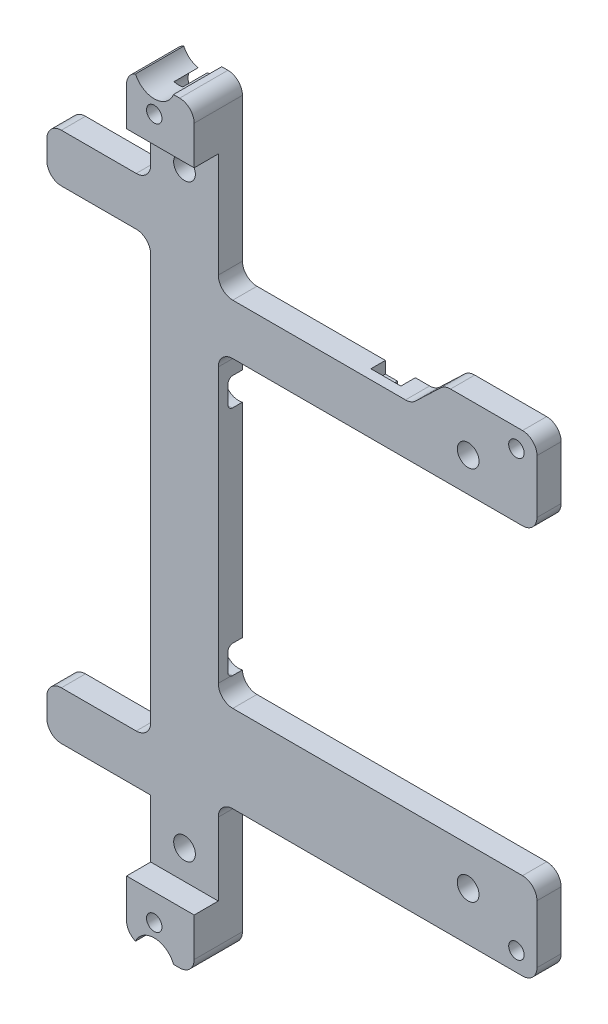
from build123d import *

# Parameters (mm, degrees)
SKETCH1_R           = 2.25
SKETCH1_R_2         = 1.6
SKETCH1_R_3         = 3
BOSS_EXTRUDE1_DEPTH = 5
SKETCH5_R           = 3
SKETCH5_R_2         = 1
SKETCH5_W           = 4.01788871
SKETCH5_H           = 5.05699797
SKETCH5_W_2         = 7.221096787
SKETCH5_H_2         = 2.706459824
CUT_EXTRUDE1_DEPTH  = 3
SKETCH7_W           = 14
SKETCH7_H           = 11
BOSS_EXTRUDE2_DEPTH = 5
SKETCH8_R           = 1.6
CUT_EXTRUDE2_DEPTH  = 10
FILLET1_R           = 3
FILLET2_R           = 1
SKETCH9_R           = 4.25
CUT_EXTRUDE3_DEPTH  = 10
SKETCH10_R          = 3
CUT_EXTRUDE4_DEPTH  = 2


with BuildPart() as part:
    # Sketch1 → Boss-Extrude1 (new body)
    with BuildSketch(Plane(origin=(0, 0, 0), x_dir=(0, 1, 0), z_dir=(0, 0, 1))):
        Polygon((-55, 65.745), (-55, 87.245), (-45, 87.245), (-45, 65.745), (45, 65.745), (45, 87.245), (55, 87.245), (55, 65.745), (78, 65.745), (78, 51.745), (42.265075728, 51.745), (42.265075728, 11.770466836), (48.886616847, 4.844257549), (48.886616847, -14.255), (31.792037683, -14.255), (31.792037683, 51.745), (-30.947612999, 51.745), (-30.947612999, -14.255), (-48.947612999, -14.255), (-48.947612999, 51.745), (-78, 51.745), (-78, 65.745), align=None)
        with Locations((-38.86, 0.005)):
            Circle(SKETCH1_R, mode=Mode.SUBTRACT)
        with Locations((38.86, -0.005)):
            Circle(SKETCH1_R, mode=Mode.SUBTRACT)
        with Locations((-60.99, 58.735)):
            Circle(SKETCH1_R, mode=Mode.SUBTRACT)
        with Locations((60.98, 58.745)):
            Circle(SKETCH1_R, mode=Mode.SUBTRACT)
        with Locations((-45, -9.995)):
            Circle(SKETCH1_R_2, mode=Mode.SUBTRACT)
        with Locations((45, -9.995)):
            Circle(SKETCH1_R_2, mode=Mode.SUBTRACT)
        with Locations((-72.5, 60.005)):
            Circle(SKETCH1_R_3, mode=Mode.SUBTRACT)
        with Locations((72.5, 60.005)):
            Circle(SKETCH1_R_3, mode=Mode.SUBTRACT)
    extrude(amount=BOSS_EXTRUDE1_DEPTH)

    # Sketch5 → Cut-Extrude1 (cut)
    with BuildSketch(Plane(origin=(0, 0, 0), x_dir=(1, 0, 0), z_dir=(0, 0, -1))):
        with Locations((-52.538289625, -22.861149672)):
            Circle(SKETCH5_R)
        with Locations((-52.538289625, 25.154380101)):
            Circle(SKETCH5_R)
        with Locations((-10.614990929, 46.988387136)):
            Circle(SKETCH5_R_2)
        with Locations((-10.614990929, 39.388387136)):
            Circle(SKETCH5_R_2)
        Polygon((-16.391055464, -39.808942168), (-15.937269245, -39.808942168), (-15.937269245, -44.809430542), (-22.144073086, -44.809430542), (-22.144073086, -39.808942168), (-19.62448258, -39.808942168), (-19.62448258, -37.764076849), (-16.391055464, -37.764076849), align=None)
        with Locations((-55.538289625, -11.127400084)):
            Rectangle(SKETCH5_W, SKETCH5_H)
        with Locations((-34.134669053, -31.792037683)):
            Rectangle(SKETCH5_W_2, SKETCH5_H_2)
    extrude(amount=-CUT_EXTRUDE1_DEPTH, mode=Mode.SUBTRACT)

    # Sketch7 → Boss-Extrude2 (add)
    with BuildSketch(Plane.XY.offset(5)):
        with Locations((-58.745, 72.5)):
            Rectangle(SKETCH7_W, SKETCH7_H)
        with Locations((-58.745, -72.5)):
            Rectangle(SKETCH7_W, SKETCH7_H)
    extrude(amount=BOSS_EXTRUDE2_DEPTH)

    # Sketch8 → Cut-Extrude2 (cut)
    with BuildSketch(Plane.XY.offset(10)):
        with Locations((-60.005, 72.5)):
            Circle(SKETCH8_R)
        with Locations((-60.005, -72.5)):
            Circle(SKETCH8_R)
    extrude(amount=-CUT_EXTRUDE2_DEPTH, mode=Mode.SUBTRACT)

    # Fillet1
    fillet1_edges = [part.edges().sort_by_distance(p)[0] for p in [
        (-51.745, -30.947612999, 2.5),
        (-65.745, -45, 2.5),
        (-87.245, -45, 2.5),
        (-87.245, -55, 2.5),
        (14.255, -48.947612999, 2.5),
        (14.255, -30.947612999, 2.5),
        (-51.745, 31.792037683, 2.5),
        (-65.745, 45, 2.5),
        (-87.245, 45, 2.5),
        (-87.245, 55, 2.5),
        (-11.770466836, 42.265075728, 2.5),
        (-4.844257549, 48.886616847, 2.5),
        (14.255, 31.792037683, 2.5),
        (14.255, 48.886616847, 2.5),
        (-51.745, 42.265075728, 2.5),
        (-51.745, 78, 5),
        (-65.745, 55, 2.5),
        (-65.745, 78, 5),
        (-51.745, -48.947612999, 2.5),
        (-51.745, -78, 5),
        (-65.745, -78, 5),
    ]]
    fillet(fillet1_edges, radius=FILLET1_R)

    # Fillet2
    fillet2_edges = [part.edges().sort_by_distance(p)[0] for p in [
        (-11.614990929, -46.988387136, 3),
        (-11.614990929, -39.388387136, 3),
        (-18.007769022, 37.764076849, 3),
        (-16.391055464, 38.786509509, 3),
        (-19.62448258, 38.786509509, 3),
        (-20.884277833, 39.808942168, 3),
        (-30.524120659, 32.468652639, 3),
        (-37.745217446, 32.468652639, 3),
        (-34.134669052, 33.145267595, 3),
        (-55.538289625, 22.861149672, 3),
        (-55.538289503, -25.155236365, 3),
        (-55.538289625, 8.598901099, 3),
        (-53.52934527, 11.127400084, 3),
        (-55.538289625, 13.655899069, 3),
        (-57.54723398, 11.127400084, 3),
    ]]
    fillet(fillet2_edges, radius=FILLET2_R)

    # Sketch9 → Cut-Extrude3 (cut)
    with BuildSketch(Plane.XY.offset(10)):
        with Locations((-60.005, 79.5)):
            Circle(SKETCH9_R)
        with Locations((-60.005, -79.5)):
            Circle(SKETCH9_R)
    extrude(amount=-CUT_EXTRUDE3_DEPTH, mode=Mode.SUBTRACT)

    # Sketch10 → Cut-Extrude4 (cut)
    with BuildSketch(Plane(origin=(0, 0, 0), x_dir=(1, 0, 0), z_dir=(0, 0, -1))):
        with Locations((9.995, 45)):
            Circle(SKETCH10_R)
        with Locations((9.995, -45)):
            Circle(SKETCH10_R)
    extrude(amount=-CUT_EXTRUDE4_DEPTH, mode=Mode.SUBTRACT)


solid = part.part
